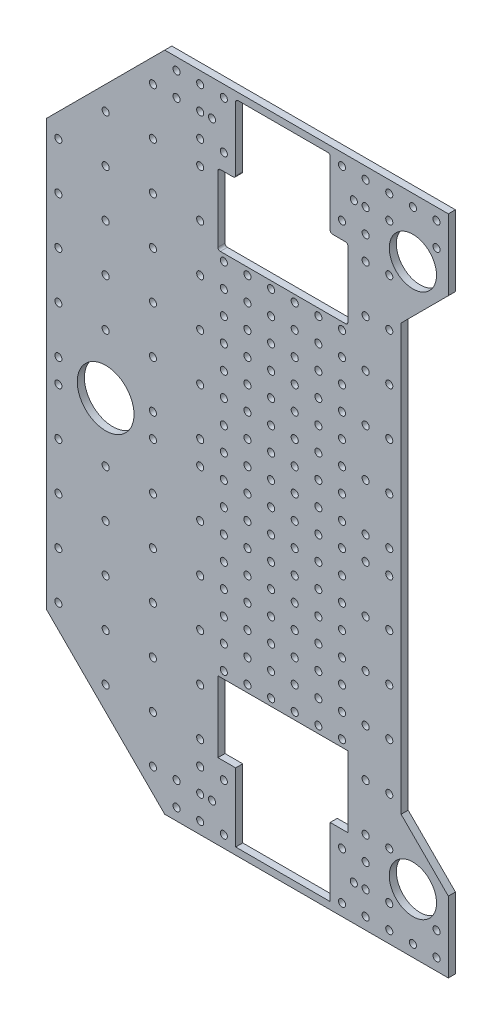
from build123d import *

# Parameters (mm, degrees)
MAIN_DEPTH                          = 3
MOTORCODERLEFTHOLE_DEPTH            = 179.070210872
FILLET1_R                           = 1
SKETCH7_R                           = 1.5
MOTORFIXHOLES_DEPTH                 = 179.070210872
MOTORFIXHOLELPATTERN_COUNT          = 8
MOTORFIXHOLELPATTERN_PITCH          = 10
SKETCH8_R                           = 1.5
LINEARBALLFIX_DEPTH                 = 179.070210872
LINEARBALLFIX2_COUNT                = 2
LINEARBALLFIX2_PITCH                = 60
SKETCH4_R                           = 1.5
BOTTOMLEFTHOLE_DEPTH                = 179.070210872
BOTTOMLEFTHOLELPATTERN_COUNT        = 9
BOTTOMLEFTHOLELPATTERN_PITCH        = 20
SKETCH5_R                           = 1.5
BOTTOMLEFTHOLE2_DEPTH               = 179.070210872
BOTTOMTOTOPPATTERN_COPY_1_SKETCH_R  = 1.5
BOTTOMTOTOPPATTERN_COPY_1_DEPTH     = 179.070210872
BOTTOMTOTOPPATTERN_COPY_2_SKETCH_R  = 1.5
BOTTOMTOTOPPATTERN_COPY_2_DEPTH     = 179.070210872
BOTTOMTOTOPPATTERN_COPY_3_SKETCH_R  = 1.5
BOTTOMTOTOPPATTERN_COPY_3_DEPTH     = 179.070210872
BOTTOMTOTOPPATTERN_COPY_4_SKETCH_R  = 1.5
BOTTOMTOTOPPATTERN_COPY_4_DEPTH     = 179.070210872
BOTTOMTOTOPPATTERN_COPY_5_SKETCH_R  = 1.5
BOTTOMTOTOPPATTERN_COPY_5_DEPTH     = 179.070210872
BOTTOMTOTOPPATTERN_COPY_6_SKETCH_R  = 1.5
BOTTOMTOTOPPATTERN_COPY_6_DEPTH     = 179.070210872
BOTTOMTOTOPPATTERN_COPY_7_SKETCH_R  = 1.5
BOTTOMTOTOPPATTERN_COPY_7_DEPTH     = 179.070210872
BOTTOMTOTOPPATTERN_COPY_8_SKETCH_R  = 1.5
BOTTOMTOTOPPATTERN_COPY_8_DEPTH     = 179.070210872
BOTTOMTOTOPPATTERN_COPY_9_SKETCH_R  = 1.5
BOTTOMTOTOPPATTERN_COPY_9_DEPTH     = 179.070210872
BOTTOMTOTOPPATTERN_COPY_10_SKETCH_R = 1.5
BOTTOMTOTOPPATTERN_COPY_10_DEPTH    = 179.070210872
BOTTOMTOTOPPATTERN_COPY_11_SKETCH_R = 1.5
BOTTOMTOTOPPATTERN_COPY_11_DEPTH    = 179.070210872
BOTTOMTOTOPPATTERN_COPY_12_SKETCH_R = 1.5
BOTTOMTOTOPPATTERN_COPY_12_DEPTH    = 179.070210872
BOTTOMTOTOPPATTERN_COPY_13_SKETCH_R = 1.5
BOTTOMTOTOPPATTERN_COPY_13_DEPTH    = 179.070210872
BOTTOMTOTOPPATTERN_COPY_14_SKETCH_R = 1.5
BOTTOMTOTOPPATTERN_COPY_14_DEPTH    = 179.070210872
BOTTOMTOTOPPATTERN_COPY_15_SKETCH_R = 1.5
BOTTOMTOTOPPATTERN_COPY_15_DEPTH    = 179.070210872
BOTTOMTOTOPPATTERN_COPY_16_SKETCH_R = 1.5
BOTTOMTOTOPPATTERN_COPY_16_DEPTH    = 179.070210872
BOTTOMTOTOPPATTERN_COPY_17_SKETCH_R = 1.5
BOTTOMTOTOPPATTERN_COPY_17_DEPTH    = 179.070210872
BOTTOMTOTOPPATTERN_COPY_18_SKETCH_R = 1.5
BOTTOMTOTOPPATTERN_COPY_18_DEPTH    = 179.070210872
BOTTOMTOTOPPATTERN_COPY_19_SKETCH_R = 1.5
BOTTOMTOTOPPATTERN_COPY_19_DEPTH    = 179.070210872
BOTTOMTOTOPPATTERN_COPY_20_SKETCH_R = 1.5
BOTTOMTOTOPPATTERN_COPY_20_DEPTH    = 179.070210872
BOTTOMTOTOPPATTERN_COPY_21_SKETCH_R = 1.5
BOTTOMTOTOPPATTERN_COPY_21_DEPTH    = 179.070210872
BOTTOMTOTOPPATTERN_COPY_22_SKETCH_R = 1.5
BOTTOMTOTOPPATTERN_COPY_22_DEPTH    = 179.070210872
BOTTOMTOTOPPATTERN_COPY_23_SKETCH_R = 1.5
BOTTOMTOTOPPATTERN_COPY_23_DEPTH    = 179.070210872
BOTTOMTOTOPPATTERN_COPY_24_SKETCH_R = 1.5
BOTTOMTOTOPPATTERN_COPY_24_DEPTH    = 179.070210872
BOTTOMTOTOPPATTERN_COPY_25_SKETCH_R = 1.5
BOTTOMTOTOPPATTERN_COPY_25_DEPTH    = 179.070210872
BOTTOMTOTOPPATTERN_COPY_26_SKETCH_R = 1.5
BOTTOMTOTOPPATTERN_COPY_26_DEPTH    = 179.070210872
BOTTOMTOTOPPATTERN_COPY_27_SKETCH_R = 1.5
BOTTOMTOTOPPATTERN_COPY_27_DEPTH    = 179.070210872
LPATTERN3_COUNT                     = 2
LPATTERN3_PITCH                     = 10
FRONTHOLES_COPY_1_SKETCH_R          = 1.5
FRONTHOLES_COPY_1_DEPTH             = 179.070210872
FRONTHOLES_COPY_2_SKETCH_R          = 1.5
FRONTHOLES_COPY_2_DEPTH             = 179.070210872
FRONTHOLES_COPY_3_SKETCH_R          = 1.5
FRONTHOLES_COPY_3_DEPTH             = 179.070210872
FRONTHOLES_COPY_4_SKETCH_R          = 1.5
FRONTHOLES_COPY_4_DEPTH             = 179.070210872
FRONTHOLES_COPY_5_SKETCH_R          = 1.5
FRONTHOLES_COPY_5_DEPTH             = 179.070210872
FRONTHOLES_COPY_6_SKETCH_R          = 1.5
FRONTHOLES_COPY_6_DEPTH             = 179.070210872
FRONTHOLES_COPY_7_SKETCH_R          = 1.5
FRONTHOLES_COPY_7_DEPTH             = 179.070210872
FRONTHOLES_COPY_8_SKETCH_R          = 1.5
FRONTHOLES_COPY_8_DEPTH             = 179.070210872
FRONTHOLES_COPY_9_SKETCH_R          = 1.5
FRONTHOLES_COPY_9_DEPTH             = 179.070210872
SKETCH9_R                           = 1.5
CUT_EXTRUDE2_DEPTH                  = 179.070210872
LPATTERN6_COPY_1_SKETCH_R           = 1.5
LPATTERN6_COPY_1_DEPTH              = 179.070210872
LPATTERN6_COPY_2_SKETCH_R           = 1.5
LPATTERN6_COPY_2_DEPTH              = 179.070210872
LPATTERN6_COPY_3_SKETCH_R           = 1.5
LPATTERN6_COPY_3_DEPTH              = 179.070210872
LPATTERN6_COPY_4_SKETCH_R           = 1.5
LPATTERN6_COPY_4_DEPTH              = 179.070210872
LPATTERN6_COPY_5_SKETCH_R           = 1.5
LPATTERN6_COPY_5_DEPTH              = 179.070210872
LPATTERN6_COPY_6_SKETCH_R           = 1.5
LPATTERN6_COPY_6_DEPTH              = 179.070210872
LPATTERN6_COPY_7_SKETCH_R           = 1.5
LPATTERN6_COPY_7_DEPTH              = 179.070210872
LPATTERN6_COPY_8_SKETCH_R           = 1.5
LPATTERN6_COPY_8_DEPTH              = 179.070210872
LPATTERN6_COPY_9_SKETCH_R           = 1.5
LPATTERN6_COPY_9_DEPTH              = 179.070210872
MIRROR1_COPY_1_SKETCH_R             = 1.5
MIRROR1_COPY_1_DEPTH                = 179.070210872
MIRROR1_COPY_2_SKETCH_R             = 1.5
MIRROR1_COPY_2_DEPTH                = 179.070210872
MIRROR1_COPY_3_SKETCH_R             = 1.5
MIRROR1_COPY_3_DEPTH                = 179.070210872
MIRROR1_COPY_4_SKETCH_R             = 1.5
MIRROR1_COPY_4_DEPTH                = 179.070210872
MIRROR1_COPY_5_SKETCH_R             = 1.5
MIRROR1_COPY_5_DEPTH                = 179.070210872
MIRROR1_COPY_6_SKETCH_R             = 1.5
MIRROR1_COPY_6_DEPTH                = 179.070210872
MIRROR1_COPY_7_SKETCH_R             = 1.5
MIRROR1_COPY_7_DEPTH                = 179.070210872
MIRROR1_COPY_8_SKETCH_R             = 1.5
MIRROR1_COPY_8_DEPTH                = 179.070210872
MIRROR1_COPY_9_SKETCH_R             = 1.5
MIRROR1_COPY_9_DEPTH                = 179.070210872
MIRROR1_COPY_10_SKETCH_R            = 1.5
MIRROR1_COPY_10_DEPTH               = 179.070210872
MIRROR1_COPY_11_SKETCH_R            = 1.5
MIRROR1_COPY_11_DEPTH               = 179.070210872
MIRROR1_COPY_12_SKETCH_R            = 1.5
MIRROR1_COPY_12_DEPTH               = 179.070210872
MIRROR1_COPY_13_SKETCH_R            = 1.5
MIRROR1_COPY_13_DEPTH               = 179.070210872
MIRROR1_COPY_14_SKETCH_R            = 1.5
MIRROR1_COPY_14_DEPTH               = 179.070210872
MIRROR1_COPY_15_SKETCH_R            = 1.5
MIRROR1_COPY_15_DEPTH               = 179.070210872
MIRROR1_COPY_16_SKETCH_R            = 1.5
MIRROR1_COPY_16_DEPTH               = 179.070210872
MIRROR1_COPY_17_SKETCH_R            = 1.5
MIRROR1_COPY_17_DEPTH               = 179.070210872
MIRROR1_COPY_18_SKETCH_R            = 1.5
MIRROR1_COPY_18_DEPTH               = 179.070210872
MIRROR1_COPY_19_SKETCH_R            = 1.5
MIRROR1_COPY_19_DEPTH               = 179.070210872
MIRROR1_COPY_20_SKETCH_R            = 1.5
MIRROR1_COPY_20_DEPTH               = 179.070210872
MIRROR1_COPY_21_SKETCH_R            = 1.5
MIRROR1_COPY_21_DEPTH               = 179.070210872
MIRROR1_COPY_22_SKETCH_R            = 1.5
MIRROR1_COPY_22_DEPTH               = 179.070210872
MIRROR1_COPY_23_SKETCH_R            = 1.5
MIRROR1_COPY_23_DEPTH               = 179.070210872
MIRROR1_COPY_24_SKETCH_R            = 1.5
MIRROR1_COPY_24_DEPTH               = 179.070210872
MIRROR1_COPY_25_SKETCH_R            = 1.5
MIRROR1_COPY_25_DEPTH               = 179.070210872
MIRROR1_COPY_26_SKETCH_R            = 1.5
MIRROR1_COPY_26_DEPTH               = 179.070210872
MIRROR1_COPY_27_SKETCH_R            = 1.5
MIRROR1_COPY_27_DEPTH               = 179.070210872
MIRROR1_COPY_28_SKETCH_R            = 1.5
MIRROR1_COPY_28_DEPTH               = 179.070210872
MIRROR1_COPY_29_SKETCH_R            = 1.5
MIRROR1_COPY_29_DEPTH               = 179.070210872
MIRROR1_COPY_30_SKETCH_R            = 1.5
MIRROR1_COPY_30_DEPTH               = 179.070210872
MIRROR1_COPY_31_SKETCH_R            = 1.5
MIRROR1_COPY_31_DEPTH               = 179.070210872
MIRROR1_COPY_32_SKETCH_R            = 1.5
MIRROR1_COPY_32_DEPTH               = 179.070210872
MIRROR1_COPY_33_SKETCH_R            = 1.5
MIRROR1_COPY_33_DEPTH               = 179.070210872
MIRROR1_COPY_34_SKETCH_R            = 1.5
MIRROR1_COPY_34_DEPTH               = 179.070210872
MIRROR1_COPY_35_SKETCH_R            = 1.5
MIRROR1_COPY_35_DEPTH               = 179.070210872
MIRROR1_COPY_36_SKETCH_R            = 1.5
MIRROR1_COPY_36_DEPTH               = 179.070210872
MIRROR1_COPY_37_SKETCH_R            = 1.5
MIRROR1_COPY_37_DEPTH               = 179.070210872
MIRROR1_COPY_38_SKETCH_R            = 1.5
MIRROR1_COPY_38_DEPTH               = 179.070210872
MIRROR1_COPY_39_SKETCH_R            = 1.5
MIRROR1_COPY_39_DEPTH               = 179.070210872
MIRROR1_COPY_40_SKETCH_R            = 1.5
MIRROR1_COPY_40_DEPTH               = 179.070210872
MIRROR1_COPY_41_SKETCH_R            = 1.5
MIRROR1_COPY_41_DEPTH               = 179.070210872
MIRROR1_COPY_42_SKETCH_R            = 1.5
MIRROR1_COPY_42_DEPTH               = 179.070210872
MIRROR1_COPY_43_SKETCH_R            = 1.5
MIRROR1_COPY_43_DEPTH               = 179.070210872
MIRROR1_COPY_44_SKETCH_R            = 1.5
MIRROR1_COPY_44_DEPTH               = 179.070210872
MIRROR1_COPY_45_SKETCH_R            = 1.5
MIRROR1_COPY_45_DEPTH               = 179.070210872
MIRROR1_COPY_46_SKETCH_R            = 1.5
MIRROR1_COPY_46_DEPTH               = 179.070210872
MIRROR1_COPY_47_SKETCH_R            = 1.5
MIRROR1_COPY_47_DEPTH               = 179.070210872
MIRROR1_COPY_48_SKETCH_R            = 1.5
MIRROR1_COPY_48_DEPTH               = 179.070210872
MIRROR1_COPY_49_SKETCH_R            = 1.5
MIRROR1_COPY_49_DEPTH               = 179.070210872
MIRROR1_COPY_50_SKETCH_R            = 1.5
MIRROR1_COPY_50_DEPTH               = 179.070210872
MIRROR1_COPY_51_SKETCH_R            = 1.5
MIRROR1_COPY_51_DEPTH               = 179.070210872
MIRROR1_COPY_52_SKETCH_R            = 1.5
MIRROR1_COPY_52_DEPTH               = 179.070210872
MIRROR1_COPY_53_SKETCH_R            = 1.5
MIRROR1_COPY_53_DEPTH               = 179.070210872
MIRROR1_COPY_54_SKETCH_R            = 1.5
MIRROR1_COPY_54_DEPTH               = 179.070210872
MIRROR1_COPY_55_SKETCH_R            = 1.5
MIRROR1_COPY_55_DEPTH               = 179.070210872
MIRROR1_COPY_56_SKETCH_R            = 1.5
MIRROR1_COPY_56_DEPTH               = 179.070210872
MIRROR1_COPY_57_SKETCH_R            = 1.5
MIRROR1_COPY_57_DEPTH               = 179.070210872
MIRROR1_COPY_58_SKETCH_R            = 1.5
MIRROR1_COPY_58_DEPTH               = 179.070210872
MIRROR1_COPY_59_SKETCH_R            = 1.5
MIRROR1_COPY_59_DEPTH               = 179.070210872
MIRROR1_COPY_60_SKETCH_R            = 1.5
MIRROR1_COPY_60_DEPTH               = 179.070210872
MIRROR1_COPY_61_SKETCH_R            = 1.5
MIRROR1_COPY_61_DEPTH               = 179.070210872
MIRROR1_COPY_62_SKETCH_R            = 1.5
MIRROR1_COPY_62_DEPTH               = 179.070210872
SKETCH3_R                           = 12
SKETCH3_R_2                         = 10
BIGHOLES_DEPTH                      = 179.070210872


with BuildPart() as part:
    # Sketch1 → Main (new body)
    with BuildSketch(Plane.XY):
        Polygon((-110, 90), (-110, -90), (-60, -140), (60, -140), (60, -110), (40, -90), (40, 90), (60, 110), (60, 140), (-60, 140), align=None)
    extrude(amount=MAIN_DEPTH)

    # Sketch2 → MotorCoderLeftHole (cut, through all)
    with BuildSketch(Plane.XY.offset(3)):
        Polygon((-37.5, 108), (-37.5, 78), (17.5, 78), (17.5, 108), (10, 108), (10, 137), (-30, 137), (-30, 108), align=None)
    motorcoderlefthole = extrude(amount=-MOTORCODERLEFTHOLE_DEPTH, mode=Mode.SUBTRACT)

    # Fillet1
    fillet1_edges = [part.edges().sort_by_distance(p)[0] for p in [
        (-30, 137, 1.5),
        (10, 108, 1.5),
        (17.5, 108, 1.5),
        (10, 137, 1.5),
        (17.5, 78, 1.5),
        (-37.5, 78, 1.5),
        (-37.5, 108, 1.5),
        (-30, 108, 1.5),
    ]]
    fillet(fillet1_edges, radius=FILLET1_R)

    # Sketch7 → MotorFixHoles (cut, through all)
    with BuildSketch(Plane.XY.offset(3)):
        with Locations((-15, 75)):
            Circle(SKETCH7_R)
        with Locations((-25, 75)):
            Circle(SKETCH7_R)
        with Locations((-5, 75)):
            Circle(SKETCH7_R)
        with Locations((-35, 75)):
            Circle(SKETCH7_R)
        with Locations((5, 75)):
            Circle(SKETCH7_R)
        with Locations((15, 75)):
            Circle(SKETCH7_R)
    motorfixholes = extrude(amount=-MOTORFIXHOLES_DEPTH, mode=Mode.SUBTRACT)

    # MotorFixHoleLPattern: MotorFixHoles ×8
    with Locations(*[(0, -i * MOTORFIXHOLELPATTERN_PITCH, 0) for i in range(1, MOTORFIXHOLELPATTERN_COUNT)]):
        add(motorfixholes, mode=Mode.SUBTRACT)

    # Sketch8 → LinearBallFix (cut, through all)
    with BuildSketch(Plane.XY.offset(3)):
        with Locations((-40, 125)):
            Circle(SKETCH8_R)
        with Locations((-45, 115)):
            Circle(SKETCH8_R)
        with Locations((-35, 115)):
            Circle(SKETCH8_R)
        with Locations((-45, 135)):
            Circle(SKETCH8_R)
        with Locations((-35, 135)):
            Circle(SKETCH8_R)
    linearballfix = extrude(amount=-LINEARBALLFIX_DEPTH, mode=Mode.SUBTRACT)

    # LinearBallFix2: LinearBallFix ×2
    with Locations(*[(i * LINEARBALLFIX2_PITCH, 0, 0) for i in range(1, LINEARBALLFIX2_COUNT)]):
        add(linearballfix, mode=Mode.SUBTRACT)

    # Sketch4 → BottomLeftHole (cut, through all)
    with BuildSketch(Plane.XY.offset(3)):
        with Locations((-105, 5)):
            Circle(SKETCH4_R)
    bottomlefthole = extrude(amount=-BOTTOMLEFTHOLE_DEPTH, mode=Mode.SUBTRACT)

    # BottomLeftHoleLPattern: BottomLeftHole ×9
    with Locations(*[(0, i * BOTTOMLEFTHOLELPATTERN_PITCH, 0) for i in range(1, BOTTOMLEFTHOLELPATTERN_COUNT)]):
        add(bottomlefthole, mode=Mode.SUBTRACT)

    # Sketch5 → BottomLeftHole2 (cut, through all)
    with BuildSketch(Plane.XY.offset(3)):
        with Locations((-55, 135)):
            Circle(SKETCH5_R)
        with Locations((35, 135)):
            Circle(SKETCH5_R)
        with Locations((55, 135)):
            Circle(SKETCH5_R)
    bottomlefthole2 = extrude(amount=-BOTTOMLEFTHOLE2_DEPTH, mode=Mode.SUBTRACT)

    # BottomToTopPattern copy 1 sketch → BottomToTopPattern copy 1 (cut, through all)
    with BuildSketch(Plane(origin=(20, 20, 3), x_dir=(1, 0, 0), z_dir=(0, 0, 1))):
        with Locations((-105, 5)):
            Circle(BOTTOMTOTOPPATTERN_COPY_1_SKETCH_R)
    extrude(amount=-BOTTOMTOTOPPATTERN_COPY_1_DEPTH, mode=Mode.SUBTRACT)

    # BottomToTopPattern copy 2 sketch → BottomToTopPattern copy 2 (cut, through all)
    with BuildSketch(Plane(origin=(40, 20, 3), x_dir=(1, 0, 0), z_dir=(0, 0, 1))):
        with Locations((-105, 5)):
            Circle(BOTTOMTOTOPPATTERN_COPY_2_SKETCH_R)
    extrude(amount=-BOTTOMTOTOPPATTERN_COPY_2_DEPTH, mode=Mode.SUBTRACT)

    # BottomToTopPattern copy 3 sketch → BottomToTopPattern copy 3 (cut, through all)
    with BuildSketch(Plane(origin=(60, 20, 3), x_dir=(1, 0, 0), z_dir=(0, 0, 1))):
        with Locations((-105, 5)):
            Circle(BOTTOMTOTOPPATTERN_COPY_3_SKETCH_R)
    extrude(amount=-BOTTOMTOTOPPATTERN_COPY_3_DEPTH, mode=Mode.SUBTRACT)

    # BottomToTopPattern copy 4 sketch → BottomToTopPattern copy 4 (cut, through all)
    with BuildSketch(Plane(origin=(20, 40, 3), x_dir=(1, 0, 0), z_dir=(0, 0, 1))):
        with Locations((-105, 5)):
            Circle(BOTTOMTOTOPPATTERN_COPY_4_SKETCH_R)
    extrude(amount=-BOTTOMTOTOPPATTERN_COPY_4_DEPTH, mode=Mode.SUBTRACT)

    # BottomToTopPattern copy 5 sketch → BottomToTopPattern copy 5 (cut, through all)
    with BuildSketch(Plane(origin=(40, 40, 3), x_dir=(1, 0, 0), z_dir=(0, 0, 1))):
        with Locations((-105, 5)):
            Circle(BOTTOMTOTOPPATTERN_COPY_5_SKETCH_R)
    extrude(amount=-BOTTOMTOTOPPATTERN_COPY_5_DEPTH, mode=Mode.SUBTRACT)

    # BottomToTopPattern copy 6 sketch → BottomToTopPattern copy 6 (cut, through all)
    with BuildSketch(Plane(origin=(60, 40, 3), x_dir=(1, 0, 0), z_dir=(0, 0, 1))):
        with Locations((-105, 5)):
            Circle(BOTTOMTOTOPPATTERN_COPY_6_SKETCH_R)
    extrude(amount=-BOTTOMTOTOPPATTERN_COPY_6_DEPTH, mode=Mode.SUBTRACT)

    # BottomToTopPattern copy 7 sketch → BottomToTopPattern copy 7 (cut, through all)
    with BuildSketch(Plane(origin=(20, 60, 3), x_dir=(1, 0, 0), z_dir=(0, 0, 1))):
        with Locations((-105, 5)):
            Circle(BOTTOMTOTOPPATTERN_COPY_7_SKETCH_R)
    extrude(amount=-BOTTOMTOTOPPATTERN_COPY_7_DEPTH, mode=Mode.SUBTRACT)

    # BottomToTopPattern copy 8 sketch → BottomToTopPattern copy 8 (cut, through all)
    with BuildSketch(Plane(origin=(40, 60, 3), x_dir=(1, 0, 0), z_dir=(0, 0, 1))):
        with Locations((-105, 5)):
            Circle(BOTTOMTOTOPPATTERN_COPY_8_SKETCH_R)
    extrude(amount=-BOTTOMTOTOPPATTERN_COPY_8_DEPTH, mode=Mode.SUBTRACT)

    # BottomToTopPattern copy 9 sketch → BottomToTopPattern copy 9 (cut, through all)
    with BuildSketch(Plane(origin=(60, 60, 3), x_dir=(1, 0, 0), z_dir=(0, 0, 1))):
        with Locations((-105, 5)):
            Circle(BOTTOMTOTOPPATTERN_COPY_9_SKETCH_R)
    extrude(amount=-BOTTOMTOTOPPATTERN_COPY_9_DEPTH, mode=Mode.SUBTRACT)

    # BottomToTopPattern copy 10 sketch → BottomToTopPattern copy 10 (cut, through all)
    with BuildSketch(Plane(origin=(20, 80, 3), x_dir=(1, 0, 0), z_dir=(0, 0, 1))):
        with Locations((-105, 5)):
            Circle(BOTTOMTOTOPPATTERN_COPY_10_SKETCH_R)
    extrude(amount=-BOTTOMTOTOPPATTERN_COPY_10_DEPTH, mode=Mode.SUBTRACT)

    # BottomToTopPattern copy 11 sketch → BottomToTopPattern copy 11 (cut, through all)
    with BuildSketch(Plane(origin=(40, 80, 3), x_dir=(1, 0, 0), z_dir=(0, 0, 1))):
        with Locations((-105, 5)):
            Circle(BOTTOMTOTOPPATTERN_COPY_11_SKETCH_R)
    extrude(amount=-BOTTOMTOTOPPATTERN_COPY_11_DEPTH, mode=Mode.SUBTRACT)

    # BottomToTopPattern copy 12 sketch → BottomToTopPattern copy 12 (cut, through all)
    with BuildSketch(Plane(origin=(60, 80, 3), x_dir=(1, 0, 0), z_dir=(0, 0, 1))):
        with Locations((-105, 5)):
            Circle(BOTTOMTOTOPPATTERN_COPY_12_SKETCH_R)
    extrude(amount=-BOTTOMTOTOPPATTERN_COPY_12_DEPTH, mode=Mode.SUBTRACT)

    # BottomToTopPattern copy 13 sketch → BottomToTopPattern copy 13 (cut, through all)
    with BuildSketch(Plane(origin=(20, 100, 3), x_dir=(1, 0, 0), z_dir=(0, 0, 1))):
        with Locations((-105, 5)):
            Circle(BOTTOMTOTOPPATTERN_COPY_13_SKETCH_R)
    extrude(amount=-BOTTOMTOTOPPATTERN_COPY_13_DEPTH, mode=Mode.SUBTRACT)

    # BottomToTopPattern copy 14 sketch → BottomToTopPattern copy 14 (cut, through all)
    with BuildSketch(Plane(origin=(40, 100, 3), x_dir=(1, 0, 0), z_dir=(0, 0, 1))):
        with Locations((-105, 5)):
            Circle(BOTTOMTOTOPPATTERN_COPY_14_SKETCH_R)
    extrude(amount=-BOTTOMTOTOPPATTERN_COPY_14_DEPTH, mode=Mode.SUBTRACT)

    # BottomToTopPattern copy 15 sketch → BottomToTopPattern copy 15 (cut, through all)
    with BuildSketch(Plane(origin=(60, 100, 3), x_dir=(1, 0, 0), z_dir=(0, 0, 1))):
        with Locations((-105, 5)):
            Circle(BOTTOMTOTOPPATTERN_COPY_15_SKETCH_R)
    extrude(amount=-BOTTOMTOTOPPATTERN_COPY_15_DEPTH, mode=Mode.SUBTRACT)

    # BottomToTopPattern copy 16 sketch → BottomToTopPattern copy 16 (cut, through all)
    with BuildSketch(Plane(origin=(20, 120, 3), x_dir=(1, 0, 0), z_dir=(0, 0, 1))):
        with Locations((-105, 5)):
            Circle(BOTTOMTOTOPPATTERN_COPY_16_SKETCH_R)
    extrude(amount=-BOTTOMTOTOPPATTERN_COPY_16_DEPTH, mode=Mode.SUBTRACT)

    # BottomToTopPattern copy 17 sketch → BottomToTopPattern copy 17 (cut, through all)
    with BuildSketch(Plane(origin=(40, 120, 3), x_dir=(1, 0, 0), z_dir=(0, 0, 1))):
        with Locations((-105, 5)):
            Circle(BOTTOMTOTOPPATTERN_COPY_17_SKETCH_R)
    extrude(amount=-BOTTOMTOTOPPATTERN_COPY_17_DEPTH, mode=Mode.SUBTRACT)

    # BottomToTopPattern copy 18 sketch → BottomToTopPattern copy 18 (cut, through all)
    with BuildSketch(Plane(origin=(60, 120, 3), x_dir=(1, 0, 0), z_dir=(0, 0, 1))):
        with Locations((-105, 5)):
            Circle(BOTTOMTOTOPPATTERN_COPY_18_SKETCH_R)
    extrude(amount=-BOTTOMTOTOPPATTERN_COPY_18_DEPTH, mode=Mode.SUBTRACT)

    # BottomToTopPattern copy 19 sketch → BottomToTopPattern copy 19 (cut, through all)
    with BuildSketch(Plane(origin=(20, 140, 3), x_dir=(1, 0, 0), z_dir=(0, 0, 1))):
        with Locations((-105, 5)):
            Circle(BOTTOMTOTOPPATTERN_COPY_19_SKETCH_R)
    extrude(amount=-BOTTOMTOTOPPATTERN_COPY_19_DEPTH, mode=Mode.SUBTRACT)

    # BottomToTopPattern copy 20 sketch → BottomToTopPattern copy 20 (cut, through all)
    with BuildSketch(Plane(origin=(40, 140, 3), x_dir=(1, 0, 0), z_dir=(0, 0, 1))):
        with Locations((-105, 5)):
            Circle(BOTTOMTOTOPPATTERN_COPY_20_SKETCH_R)
    extrude(amount=-BOTTOMTOTOPPATTERN_COPY_20_DEPTH, mode=Mode.SUBTRACT)

    # BottomToTopPattern copy 21 sketch → BottomToTopPattern copy 21 (cut, through all)
    with BuildSketch(Plane(origin=(60, 140, 3), x_dir=(1, 0, 0), z_dir=(0, 0, 1))):
        with Locations((-105, 5)):
            Circle(BOTTOMTOTOPPATTERN_COPY_21_SKETCH_R)
    extrude(amount=-BOTTOMTOTOPPATTERN_COPY_21_DEPTH, mode=Mode.SUBTRACT)

    # BottomToTopPattern copy 22 sketch → BottomToTopPattern copy 22 (cut, through all)
    with BuildSketch(Plane(origin=(20, 160, 3), x_dir=(1, 0, 0), z_dir=(0, 0, 1))):
        with Locations((-105, 5)):
            Circle(BOTTOMTOTOPPATTERN_COPY_22_SKETCH_R)
    extrude(amount=-BOTTOMTOTOPPATTERN_COPY_22_DEPTH, mode=Mode.SUBTRACT)

    # BottomToTopPattern copy 23 sketch → BottomToTopPattern copy 23 (cut, through all)
    with BuildSketch(Plane(origin=(40, 160, 3), x_dir=(1, 0, 0), z_dir=(0, 0, 1))):
        with Locations((-105, 5)):
            Circle(BOTTOMTOTOPPATTERN_COPY_23_SKETCH_R)
    extrude(amount=-BOTTOMTOTOPPATTERN_COPY_23_DEPTH, mode=Mode.SUBTRACT)

    # BottomToTopPattern copy 24 sketch → BottomToTopPattern copy 24 (cut, through all)
    with BuildSketch(Plane(origin=(60, 160, 3), x_dir=(1, 0, 0), z_dir=(0, 0, 1))):
        with Locations((-105, 5)):
            Circle(BOTTOMTOTOPPATTERN_COPY_24_SKETCH_R)
    extrude(amount=-BOTTOMTOTOPPATTERN_COPY_24_DEPTH, mode=Mode.SUBTRACT)

    # BottomToTopPattern copy 25 sketch → BottomToTopPattern copy 25 (cut, through all)
    with BuildSketch(Plane(origin=(20, 0, 3), x_dir=(1, 0, 0), z_dir=(0, 0, 1))):
        with Locations((-105, 5)):
            Circle(BOTTOMTOTOPPATTERN_COPY_25_SKETCH_R)
    extrude(amount=-BOTTOMTOTOPPATTERN_COPY_25_DEPTH, mode=Mode.SUBTRACT)

    # BottomToTopPattern copy 26 sketch → BottomToTopPattern copy 26 (cut, through all)
    with BuildSketch(Plane(origin=(40, 0, 3), x_dir=(1, 0, 0), z_dir=(0, 0, 1))):
        with Locations((-105, 5)):
            Circle(BOTTOMTOTOPPATTERN_COPY_26_SKETCH_R)
    extrude(amount=-BOTTOMTOTOPPATTERN_COPY_26_DEPTH, mode=Mode.SUBTRACT)

    # BottomToTopPattern copy 27 sketch → BottomToTopPattern copy 27 (cut, through all)
    with BuildSketch(Plane(origin=(60, 0, 3), x_dir=(1, 0, 0), z_dir=(0, 0, 1))):
        with Locations((-105, 5)):
            Circle(BOTTOMTOTOPPATTERN_COPY_27_SKETCH_R)
    extrude(amount=-BOTTOMTOTOPPATTERN_COPY_27_DEPTH, mode=Mode.SUBTRACT)

    # LPattern3: BottomLeftHole2 ×2
    with Locations(*[(0, -i * LPATTERN3_PITCH, 0) for i in range(1, LPATTERN3_COUNT)]):
        add(bottomlefthole2, mode=Mode.SUBTRACT)

    # FrontHoles copy 1 sketch → FrontHoles copy 1 (cut, through all)
    with BuildSketch(Plane(origin=(140, 20, 3), x_dir=(1, 0, 0), z_dir=(0, 0, 1))):
        with Locations((-105, 5)):
            Circle(FRONTHOLES_COPY_1_SKETCH_R)
    extrude(amount=-FRONTHOLES_COPY_1_DEPTH, mode=Mode.SUBTRACT)

    # FrontHoles copy 2 sketch → FrontHoles copy 2 (cut, through all)
    with BuildSketch(Plane(origin=(140, 40, 3), x_dir=(1, 0, 0), z_dir=(0, 0, 1))):
        with Locations((-105, 5)):
            Circle(FRONTHOLES_COPY_2_SKETCH_R)
    extrude(amount=-FRONTHOLES_COPY_2_DEPTH, mode=Mode.SUBTRACT)

    # FrontHoles copy 3 sketch → FrontHoles copy 3 (cut, through all)
    with BuildSketch(Plane(origin=(140, 60, 3), x_dir=(1, 0, 0), z_dir=(0, 0, 1))):
        with Locations((-105, 5)):
            Circle(FRONTHOLES_COPY_3_SKETCH_R)
    extrude(amount=-FRONTHOLES_COPY_3_DEPTH, mode=Mode.SUBTRACT)

    # FrontHoles copy 4 sketch → FrontHoles copy 4 (cut, through all)
    with BuildSketch(Plane(origin=(140, 80, 3), x_dir=(1, 0, 0), z_dir=(0, 0, 1))):
        with Locations((-105, 5)):
            Circle(FRONTHOLES_COPY_4_SKETCH_R)
    extrude(amount=-FRONTHOLES_COPY_4_DEPTH, mode=Mode.SUBTRACT)

    # FrontHoles copy 5 sketch → FrontHoles copy 5 (cut, through all)
    with BuildSketch(Plane(origin=(140, 100, 3), x_dir=(1, 0, 0), z_dir=(0, 0, 1))):
        with Locations((-105, 5)):
            Circle(FRONTHOLES_COPY_5_SKETCH_R)
    extrude(amount=-FRONTHOLES_COPY_5_DEPTH, mode=Mode.SUBTRACT)

    # FrontHoles copy 6 sketch → FrontHoles copy 6 (cut, through all)
    with BuildSketch(Plane(origin=(140, 120, 3), x_dir=(1, 0, 0), z_dir=(0, 0, 1))):
        with Locations((-105, 5)):
            Circle(FRONTHOLES_COPY_6_SKETCH_R)
    extrude(amount=-FRONTHOLES_COPY_6_DEPTH, mode=Mode.SUBTRACT)

    # FrontHoles copy 7 sketch → FrontHoles copy 7 (cut, through all)
    with BuildSketch(Plane(origin=(140, 140, 3), x_dir=(1, 0, 0), z_dir=(0, 0, 1))):
        with Locations((-105, 5)):
            Circle(FRONTHOLES_COPY_7_SKETCH_R)
    extrude(amount=-FRONTHOLES_COPY_7_DEPTH, mode=Mode.SUBTRACT)

    # FrontHoles copy 8 sketch → FrontHoles copy 8 (cut, through all)
    with BuildSketch(Plane(origin=(140, 160, 3), x_dir=(1, 0, 0), z_dir=(0, 0, 1))):
        with Locations((-105, 5)):
            Circle(FRONTHOLES_COPY_8_SKETCH_R)
    extrude(amount=-FRONTHOLES_COPY_8_DEPTH, mode=Mode.SUBTRACT)

    # FrontHoles copy 9 sketch → FrontHoles copy 9 (cut, through all)
    with BuildSketch(Plane(origin=(140, 0, 3), x_dir=(1, 0, 0), z_dir=(0, 0, 1))):
        with Locations((-105, 5)):
            Circle(FRONTHOLES_COPY_9_SKETCH_R)
    extrude(amount=-FRONTHOLES_COPY_9_DEPTH, mode=Mode.SUBTRACT)

    # Sketch9 → Cut-Extrude2 (cut, through all)
    with BuildSketch(Plane.XY.offset(3)):
        with Locations((-85, 25)):
            Circle(SKETCH9_R)
        with Locations((-65, 25)):
            Circle(SKETCH9_R)
        with Locations((-45, 25)):
            Circle(SKETCH9_R)
        with Locations((-65, 45)):
            Circle(SKETCH9_R)
        with Locations((35, 105)):
            Circle(SKETCH9_R)
        with Locations((45, 135)):
            Circle(SKETCH9_R)
    cut_extrude2 = extrude(amount=-CUT_EXTRUDE2_DEPTH, mode=Mode.SUBTRACT)

    # LPattern6 copy 1 sketch → LPattern6 copy 1 (cut, through all)
    with BuildSketch(Plane(origin=(130, 20, 3), x_dir=(1, 0, 0), z_dir=(0, 0, 1))):
        with Locations((-105, 5)):
            Circle(LPATTERN6_COPY_1_SKETCH_R)
    extrude(amount=-LPATTERN6_COPY_1_DEPTH, mode=Mode.SUBTRACT)

    # LPattern6 copy 2 sketch → LPattern6 copy 2 (cut, through all)
    with BuildSketch(Plane(origin=(130, 40, 3), x_dir=(1, 0, 0), z_dir=(0, 0, 1))):
        with Locations((-105, 5)):
            Circle(LPATTERN6_COPY_2_SKETCH_R)
    extrude(amount=-LPATTERN6_COPY_2_DEPTH, mode=Mode.SUBTRACT)

    # LPattern6 copy 3 sketch → LPattern6 copy 3 (cut, through all)
    with BuildSketch(Plane(origin=(130, 60, 3), x_dir=(1, 0, 0), z_dir=(0, 0, 1))):
        with Locations((-105, 5)):
            Circle(LPATTERN6_COPY_3_SKETCH_R)
    extrude(amount=-LPATTERN6_COPY_3_DEPTH, mode=Mode.SUBTRACT)

    # LPattern6 copy 4 sketch → LPattern6 copy 4 (cut, through all)
    with BuildSketch(Plane(origin=(130, 80, 3), x_dir=(1, 0, 0), z_dir=(0, 0, 1))):
        with Locations((-105, 5)):
            Circle(LPATTERN6_COPY_4_SKETCH_R)
    extrude(amount=-LPATTERN6_COPY_4_DEPTH, mode=Mode.SUBTRACT)

    # LPattern6 copy 5 sketch → LPattern6 copy 5 (cut, through all)
    with BuildSketch(Plane(origin=(130, 100, 3), x_dir=(1, 0, 0), z_dir=(0, 0, 1))):
        with Locations((-105, 5)):
            Circle(LPATTERN6_COPY_5_SKETCH_R)
    extrude(amount=-LPATTERN6_COPY_5_DEPTH, mode=Mode.SUBTRACT)

    # LPattern6 copy 6 sketch → LPattern6 copy 6 (cut, through all)
    with BuildSketch(Plane(origin=(130, 120, 3), x_dir=(1, 0, 0), z_dir=(0, 0, 1))):
        with Locations((-105, 5)):
            Circle(LPATTERN6_COPY_6_SKETCH_R)
    extrude(amount=-LPATTERN6_COPY_6_DEPTH, mode=Mode.SUBTRACT)

    # LPattern6 copy 7 sketch → LPattern6 copy 7 (cut, through all)
    with BuildSketch(Plane(origin=(130, 140, 3), x_dir=(1, 0, 0), z_dir=(0, 0, 1))):
        with Locations((-105, 5)):
            Circle(LPATTERN6_COPY_7_SKETCH_R)
    extrude(amount=-LPATTERN6_COPY_7_DEPTH, mode=Mode.SUBTRACT)

    # LPattern6 copy 8 sketch → LPattern6 copy 8 (cut, through all)
    with BuildSketch(Plane(origin=(130, 160, 3), x_dir=(1, 0, 0), z_dir=(0, 0, 1))):
        with Locations((-105, 5)):
            Circle(LPATTERN6_COPY_8_SKETCH_R)
    extrude(amount=-LPATTERN6_COPY_8_DEPTH, mode=Mode.SUBTRACT)

    # LPattern6 copy 9 sketch → LPattern6 copy 9 (cut, through all)
    with BuildSketch(Plane(origin=(130, 0, 3), x_dir=(1, 0, 0), z_dir=(0, 0, 1))):
        with Locations((-105, 5)):
            Circle(LPATTERN6_COPY_9_SKETCH_R)
    extrude(amount=-LPATTERN6_COPY_9_DEPTH, mode=Mode.SUBTRACT)

    # Mirror1: MotorCoderLeftHole, MotorFixHoles, LinearBallFix, BottomLeftHole, BottomLeftHole2, Cut-Extrude2 across plane
    add(motorcoderlefthole.mirror(Plane.ZX), mode=Mode.SUBTRACT)
    add(motorfixholes.mirror(Plane.ZX), mode=Mode.SUBTRACT)
    add(linearballfix.mirror(Plane.ZX), mode=Mode.SUBTRACT)
    add(bottomlefthole.mirror(Plane.ZX), mode=Mode.SUBTRACT)
    add(bottomlefthole2.mirror(Plane.ZX), mode=Mode.SUBTRACT)
    add(cut_extrude2.mirror(Plane.ZX), mode=Mode.SUBTRACT)

    # Mirror1 copy 1 sketch → Mirror1 copy 1 (cut, through all)
    with BuildSketch(Plane(origin=(0, 10, 3), x_dir=(1, 0, 0), z_dir=(0, 0, 1))):
        with Locations((-15, -75)):
            Circle(MIRROR1_COPY_1_SKETCH_R)
        with Locations((-25, -75)):
            Circle(MIRROR1_COPY_1_SKETCH_R)
        with Locations((-5, -75)):
            Circle(MIRROR1_COPY_1_SKETCH_R)
        with Locations((-35, -75)):
            Circle(MIRROR1_COPY_1_SKETCH_R)
        with Locations((5, -75)):
            Circle(MIRROR1_COPY_1_SKETCH_R)
        with Locations((15, -75)):
            Circle(MIRROR1_COPY_1_SKETCH_R)
    extrude(amount=-MIRROR1_COPY_1_DEPTH, mode=Mode.SUBTRACT)

    # Mirror1 copy 2 sketch → Mirror1 copy 2 (cut, through all)
    with BuildSketch(Plane(origin=(0, 20, 3), x_dir=(1, 0, 0), z_dir=(0, 0, 1))):
        with Locations((-15, -75)):
            Circle(MIRROR1_COPY_2_SKETCH_R)
        with Locations((-25, -75)):
            Circle(MIRROR1_COPY_2_SKETCH_R)
        with Locations((-5, -75)):
            Circle(MIRROR1_COPY_2_SKETCH_R)
        with Locations((-35, -75)):
            Circle(MIRROR1_COPY_2_SKETCH_R)
        with Locations((5, -75)):
            Circle(MIRROR1_COPY_2_SKETCH_R)
        with Locations((15, -75)):
            Circle(MIRROR1_COPY_2_SKETCH_R)
    extrude(amount=-MIRROR1_COPY_2_DEPTH, mode=Mode.SUBTRACT)

    # Mirror1 copy 3 sketch → Mirror1 copy 3 (cut, through all)
    with BuildSketch(Plane(origin=(0, 30, 3), x_dir=(1, 0, 0), z_dir=(0, 0, 1))):
        with Locations((-15, -75)):
            Circle(MIRROR1_COPY_3_SKETCH_R)
        with Locations((-25, -75)):
            Circle(MIRROR1_COPY_3_SKETCH_R)
        with Locations((-5, -75)):
            Circle(MIRROR1_COPY_3_SKETCH_R)
        with Locations((-35, -75)):
            Circle(MIRROR1_COPY_3_SKETCH_R)
        with Locations((5, -75)):
            Circle(MIRROR1_COPY_3_SKETCH_R)
        with Locations((15, -75)):
            Circle(MIRROR1_COPY_3_SKETCH_R)
    extrude(amount=-MIRROR1_COPY_3_DEPTH, mode=Mode.SUBTRACT)

    # Mirror1 copy 4 sketch → Mirror1 copy 4 (cut, through all)
    with BuildSketch(Plane(origin=(0, 40, 3), x_dir=(1, 0, 0), z_dir=(0, 0, 1))):
        with Locations((-15, -75)):
            Circle(MIRROR1_COPY_4_SKETCH_R)
        with Locations((-25, -75)):
            Circle(MIRROR1_COPY_4_SKETCH_R)
        with Locations((-5, -75)):
            Circle(MIRROR1_COPY_4_SKETCH_R)
        with Locations((-35, -75)):
            Circle(MIRROR1_COPY_4_SKETCH_R)
        with Locations((5, -75)):
            Circle(MIRROR1_COPY_4_SKETCH_R)
        with Locations((15, -75)):
            Circle(MIRROR1_COPY_4_SKETCH_R)
    extrude(amount=-MIRROR1_COPY_4_DEPTH, mode=Mode.SUBTRACT)

    # Mirror1 copy 5 sketch → Mirror1 copy 5 (cut, through all)
    with BuildSketch(Plane(origin=(0, 50, 3), x_dir=(1, 0, 0), z_dir=(0, 0, 1))):
        with Locations((-15, -75)):
            Circle(MIRROR1_COPY_5_SKETCH_R)
        with Locations((-25, -75)):
            Circle(MIRROR1_COPY_5_SKETCH_R)
        with Locations((-5, -75)):
            Circle(MIRROR1_COPY_5_SKETCH_R)
        with Locations((-35, -75)):
            Circle(MIRROR1_COPY_5_SKETCH_R)
        with Locations((5, -75)):
            Circle(MIRROR1_COPY_5_SKETCH_R)
        with Locations((15, -75)):
            Circle(MIRROR1_COPY_5_SKETCH_R)
    extrude(amount=-MIRROR1_COPY_5_DEPTH, mode=Mode.SUBTRACT)

    # Mirror1 copy 6 sketch → Mirror1 copy 6 (cut, through all)
    with BuildSketch(Plane(origin=(0, 60, 3), x_dir=(1, 0, 0), z_dir=(0, 0, 1))):
        with Locations((-15, -75)):
            Circle(MIRROR1_COPY_6_SKETCH_R)
        with Locations((-25, -75)):
            Circle(MIRROR1_COPY_6_SKETCH_R)
        with Locations((-5, -75)):
            Circle(MIRROR1_COPY_6_SKETCH_R)
        with Locations((-35, -75)):
            Circle(MIRROR1_COPY_6_SKETCH_R)
        with Locations((5, -75)):
            Circle(MIRROR1_COPY_6_SKETCH_R)
        with Locations((15, -75)):
            Circle(MIRROR1_COPY_6_SKETCH_R)
    extrude(amount=-MIRROR1_COPY_6_DEPTH, mode=Mode.SUBTRACT)

    # Mirror1 copy 7 sketch → Mirror1 copy 7 (cut, through all)
    with BuildSketch(Plane(origin=(0, 70, 3), x_dir=(1, 0, 0), z_dir=(0, 0, 1))):
        with Locations((-15, -75)):
            Circle(MIRROR1_COPY_7_SKETCH_R)
        with Locations((-25, -75)):
            Circle(MIRROR1_COPY_7_SKETCH_R)
        with Locations((-5, -75)):
            Circle(MIRROR1_COPY_7_SKETCH_R)
        with Locations((-35, -75)):
            Circle(MIRROR1_COPY_7_SKETCH_R)
        with Locations((5, -75)):
            Circle(MIRROR1_COPY_7_SKETCH_R)
        with Locations((15, -75)):
            Circle(MIRROR1_COPY_7_SKETCH_R)
    extrude(amount=-MIRROR1_COPY_7_DEPTH, mode=Mode.SUBTRACT)

    # Mirror1 copy 8 sketch → Mirror1 copy 8 (cut, through all)
    with BuildSketch(Plane(origin=(60, 0, 3), x_dir=(1, 0, 0), z_dir=(0, 0, 1))):
        with Locations((-40, -125)):
            Circle(MIRROR1_COPY_8_SKETCH_R)
        with Locations((-45, -115)):
            Circle(MIRROR1_COPY_8_SKETCH_R)
        with Locations((-35, -115)):
            Circle(MIRROR1_COPY_8_SKETCH_R)
        with Locations((-45, -135)):
            Circle(MIRROR1_COPY_8_SKETCH_R)
        with Locations((-35, -135)):
            Circle(MIRROR1_COPY_8_SKETCH_R)
    extrude(amount=-MIRROR1_COPY_8_DEPTH, mode=Mode.SUBTRACT)

    # Mirror1 copy 9 sketch → Mirror1 copy 9 (cut, through all)
    with BuildSketch(Plane(origin=(0, -20, 3), x_dir=(1, 0, 0), z_dir=(0, 0, 1))):
        with Locations((-105, -5)):
            Circle(MIRROR1_COPY_9_SKETCH_R)
    extrude(amount=-MIRROR1_COPY_9_DEPTH, mode=Mode.SUBTRACT)

    # Mirror1 copy 10 sketch → Mirror1 copy 10 (cut, through all)
    with BuildSketch(Plane(origin=(0, -40, 3), x_dir=(1, 0, 0), z_dir=(0, 0, 1))):
        with Locations((-105, -5)):
            Circle(MIRROR1_COPY_10_SKETCH_R)
    extrude(amount=-MIRROR1_COPY_10_DEPTH, mode=Mode.SUBTRACT)

    # Mirror1 copy 11 sketch → Mirror1 copy 11 (cut, through all)
    with BuildSketch(Plane(origin=(0, -60, 3), x_dir=(1, 0, 0), z_dir=(0, 0, 1))):
        with Locations((-105, -5)):
            Circle(MIRROR1_COPY_11_SKETCH_R)
    extrude(amount=-MIRROR1_COPY_11_DEPTH, mode=Mode.SUBTRACT)

    # Mirror1 copy 12 sketch → Mirror1 copy 12 (cut, through all)
    with BuildSketch(Plane(origin=(0, -80, 3), x_dir=(1, 0, 0), z_dir=(0, 0, 1))):
        with Locations((-105, -5)):
            Circle(MIRROR1_COPY_12_SKETCH_R)
    extrude(amount=-MIRROR1_COPY_12_DEPTH, mode=Mode.SUBTRACT)

    # Mirror1 copy 13 sketch → Mirror1 copy 13 (cut, through all)
    with BuildSketch(Plane(origin=(0, -100, 3), x_dir=(1, 0, 0), z_dir=(0, 0, 1))):
        with Locations((-105, -5)):
            Circle(MIRROR1_COPY_13_SKETCH_R)
    extrude(amount=-MIRROR1_COPY_13_DEPTH, mode=Mode.SUBTRACT)

    # Mirror1 copy 14 sketch → Mirror1 copy 14 (cut, through all)
    with BuildSketch(Plane(origin=(0, -120, 3), x_dir=(1, 0, 0), z_dir=(0, 0, 1))):
        with Locations((-105, -5)):
            Circle(MIRROR1_COPY_14_SKETCH_R)
    extrude(amount=-MIRROR1_COPY_14_DEPTH, mode=Mode.SUBTRACT)

    # Mirror1 copy 15 sketch → Mirror1 copy 15 (cut, through all)
    with BuildSketch(Plane(origin=(0, -140, 3), x_dir=(1, 0, 0), z_dir=(0, 0, 1))):
        with Locations((-105, -5)):
            Circle(MIRROR1_COPY_15_SKETCH_R)
    extrude(amount=-MIRROR1_COPY_15_DEPTH, mode=Mode.SUBTRACT)

    # Mirror1 copy 16 sketch → Mirror1 copy 16 (cut, through all)
    with BuildSketch(Plane(origin=(0, -160, 3), x_dir=(1, 0, 0), z_dir=(0, 0, 1))):
        with Locations((-105, -5)):
            Circle(MIRROR1_COPY_16_SKETCH_R)
    extrude(amount=-MIRROR1_COPY_16_DEPTH, mode=Mode.SUBTRACT)

    # Mirror1 copy 17 sketch → Mirror1 copy 17 (cut, through all)
    with BuildSketch(Plane(origin=(20, -20, 3), x_dir=(1, 0, 0), z_dir=(0, 0, 1))):
        with Locations((-105, -5)):
            Circle(MIRROR1_COPY_17_SKETCH_R)
    extrude(amount=-MIRROR1_COPY_17_DEPTH, mode=Mode.SUBTRACT)

    # Mirror1 copy 18 sketch → Mirror1 copy 18 (cut, through all)
    with BuildSketch(Plane(origin=(40, -20, 3), x_dir=(1, 0, 0), z_dir=(0, 0, 1))):
        with Locations((-105, -5)):
            Circle(MIRROR1_COPY_18_SKETCH_R)
    extrude(amount=-MIRROR1_COPY_18_DEPTH, mode=Mode.SUBTRACT)

    # Mirror1 copy 19 sketch → Mirror1 copy 19 (cut, through all)
    with BuildSketch(Plane(origin=(60, -20, 3), x_dir=(1, 0, 0), z_dir=(0, 0, 1))):
        with Locations((-105, -5)):
            Circle(MIRROR1_COPY_19_SKETCH_R)
    extrude(amount=-MIRROR1_COPY_19_DEPTH, mode=Mode.SUBTRACT)

    # Mirror1 copy 20 sketch → Mirror1 copy 20 (cut, through all)
    with BuildSketch(Plane(origin=(20, -40, 3), x_dir=(1, 0, 0), z_dir=(0, 0, 1))):
        with Locations((-105, -5)):
            Circle(MIRROR1_COPY_20_SKETCH_R)
    extrude(amount=-MIRROR1_COPY_20_DEPTH, mode=Mode.SUBTRACT)

    # Mirror1 copy 21 sketch → Mirror1 copy 21 (cut, through all)
    with BuildSketch(Plane(origin=(40, -40, 3), x_dir=(1, 0, 0), z_dir=(0, 0, 1))):
        with Locations((-105, -5)):
            Circle(MIRROR1_COPY_21_SKETCH_R)
    extrude(amount=-MIRROR1_COPY_21_DEPTH, mode=Mode.SUBTRACT)

    # Mirror1 copy 22 sketch → Mirror1 copy 22 (cut, through all)
    with BuildSketch(Plane(origin=(60, -40, 3), x_dir=(1, 0, 0), z_dir=(0, 0, 1))):
        with Locations((-105, -5)):
            Circle(MIRROR1_COPY_22_SKETCH_R)
    extrude(amount=-MIRROR1_COPY_22_DEPTH, mode=Mode.SUBTRACT)

    # Mirror1 copy 23 sketch → Mirror1 copy 23 (cut, through all)
    with BuildSketch(Plane(origin=(20, -60, 3), x_dir=(1, 0, 0), z_dir=(0, 0, 1))):
        with Locations((-105, -5)):
            Circle(MIRROR1_COPY_23_SKETCH_R)
    extrude(amount=-MIRROR1_COPY_23_DEPTH, mode=Mode.SUBTRACT)

    # Mirror1 copy 24 sketch → Mirror1 copy 24 (cut, through all)
    with BuildSketch(Plane(origin=(40, -60, 3), x_dir=(1, 0, 0), z_dir=(0, 0, 1))):
        with Locations((-105, -5)):
            Circle(MIRROR1_COPY_24_SKETCH_R)
    extrude(amount=-MIRROR1_COPY_24_DEPTH, mode=Mode.SUBTRACT)

    # Mirror1 copy 25 sketch → Mirror1 copy 25 (cut, through all)
    with BuildSketch(Plane(origin=(60, -60, 3), x_dir=(1, 0, 0), z_dir=(0, 0, 1))):
        with Locations((-105, -5)):
            Circle(MIRROR1_COPY_25_SKETCH_R)
    extrude(amount=-MIRROR1_COPY_25_DEPTH, mode=Mode.SUBTRACT)

    # Mirror1 copy 26 sketch → Mirror1 copy 26 (cut, through all)
    with BuildSketch(Plane(origin=(20, -80, 3), x_dir=(1, 0, 0), z_dir=(0, 0, 1))):
        with Locations((-105, -5)):
            Circle(MIRROR1_COPY_26_SKETCH_R)
    extrude(amount=-MIRROR1_COPY_26_DEPTH, mode=Mode.SUBTRACT)

    # Mirror1 copy 27 sketch → Mirror1 copy 27 (cut, through all)
    with BuildSketch(Plane(origin=(40, -80, 3), x_dir=(1, 0, 0), z_dir=(0, 0, 1))):
        with Locations((-105, -5)):
            Circle(MIRROR1_COPY_27_SKETCH_R)
    extrude(amount=-MIRROR1_COPY_27_DEPTH, mode=Mode.SUBTRACT)

    # Mirror1 copy 28 sketch → Mirror1 copy 28 (cut, through all)
    with BuildSketch(Plane(origin=(60, -80, 3), x_dir=(1, 0, 0), z_dir=(0, 0, 1))):
        with Locations((-105, -5)):
            Circle(MIRROR1_COPY_28_SKETCH_R)
    extrude(amount=-MIRROR1_COPY_28_DEPTH, mode=Mode.SUBTRACT)

    # Mirror1 copy 29 sketch → Mirror1 copy 29 (cut, through all)
    with BuildSketch(Plane(origin=(20, -100, 3), x_dir=(1, 0, 0), z_dir=(0, 0, 1))):
        with Locations((-105, -5)):
            Circle(MIRROR1_COPY_29_SKETCH_R)
    extrude(amount=-MIRROR1_COPY_29_DEPTH, mode=Mode.SUBTRACT)

    # Mirror1 copy 30 sketch → Mirror1 copy 30 (cut, through all)
    with BuildSketch(Plane(origin=(40, -100, 3), x_dir=(1, 0, 0), z_dir=(0, 0, 1))):
        with Locations((-105, -5)):
            Circle(MIRROR1_COPY_30_SKETCH_R)
    extrude(amount=-MIRROR1_COPY_30_DEPTH, mode=Mode.SUBTRACT)

    # Mirror1 copy 31 sketch → Mirror1 copy 31 (cut, through all)
    with BuildSketch(Plane(origin=(60, -100, 3), x_dir=(1, 0, 0), z_dir=(0, 0, 1))):
        with Locations((-105, -5)):
            Circle(MIRROR1_COPY_31_SKETCH_R)
    extrude(amount=-MIRROR1_COPY_31_DEPTH, mode=Mode.SUBTRACT)

    # Mirror1 copy 32 sketch → Mirror1 copy 32 (cut, through all)
    with BuildSketch(Plane(origin=(20, -120, 3), x_dir=(1, 0, 0), z_dir=(0, 0, 1))):
        with Locations((-105, -5)):
            Circle(MIRROR1_COPY_32_SKETCH_R)
    extrude(amount=-MIRROR1_COPY_32_DEPTH, mode=Mode.SUBTRACT)

    # Mirror1 copy 33 sketch → Mirror1 copy 33 (cut, through all)
    with BuildSketch(Plane(origin=(40, -120, 3), x_dir=(1, 0, 0), z_dir=(0, 0, 1))):
        with Locations((-105, -5)):
            Circle(MIRROR1_COPY_33_SKETCH_R)
    extrude(amount=-MIRROR1_COPY_33_DEPTH, mode=Mode.SUBTRACT)

    # Mirror1 copy 34 sketch → Mirror1 copy 34 (cut, through all)
    with BuildSketch(Plane(origin=(60, -120, 3), x_dir=(1, 0, 0), z_dir=(0, 0, 1))):
        with Locations((-105, -5)):
            Circle(MIRROR1_COPY_34_SKETCH_R)
    extrude(amount=-MIRROR1_COPY_34_DEPTH, mode=Mode.SUBTRACT)

    # Mirror1 copy 35 sketch → Mirror1 copy 35 (cut, through all)
    with BuildSketch(Plane(origin=(20, -140, 3), x_dir=(1, 0, 0), z_dir=(0, 0, 1))):
        with Locations((-105, -5)):
            Circle(MIRROR1_COPY_35_SKETCH_R)
    extrude(amount=-MIRROR1_COPY_35_DEPTH, mode=Mode.SUBTRACT)

    # Mirror1 copy 36 sketch → Mirror1 copy 36 (cut, through all)
    with BuildSketch(Plane(origin=(40, -140, 3), x_dir=(1, 0, 0), z_dir=(0, 0, 1))):
        with Locations((-105, -5)):
            Circle(MIRROR1_COPY_36_SKETCH_R)
    extrude(amount=-MIRROR1_COPY_36_DEPTH, mode=Mode.SUBTRACT)

    # Mirror1 copy 37 sketch → Mirror1 copy 37 (cut, through all)
    with BuildSketch(Plane(origin=(60, -140, 3), x_dir=(1, 0, 0), z_dir=(0, 0, 1))):
        with Locations((-105, -5)):
            Circle(MIRROR1_COPY_37_SKETCH_R)
    extrude(amount=-MIRROR1_COPY_37_DEPTH, mode=Mode.SUBTRACT)

    # Mirror1 copy 38 sketch → Mirror1 copy 38 (cut, through all)
    with BuildSketch(Plane(origin=(20, -160, 3), x_dir=(1, 0, 0), z_dir=(0, 0, 1))):
        with Locations((-105, -5)):
            Circle(MIRROR1_COPY_38_SKETCH_R)
    extrude(amount=-MIRROR1_COPY_38_DEPTH, mode=Mode.SUBTRACT)

    # Mirror1 copy 39 sketch → Mirror1 copy 39 (cut, through all)
    with BuildSketch(Plane(origin=(40, -160, 3), x_dir=(1, 0, 0), z_dir=(0, 0, 1))):
        with Locations((-105, -5)):
            Circle(MIRROR1_COPY_39_SKETCH_R)
    extrude(amount=-MIRROR1_COPY_39_DEPTH, mode=Mode.SUBTRACT)

    # Mirror1 copy 40 sketch → Mirror1 copy 40 (cut, through all)
    with BuildSketch(Plane(origin=(60, -160, 3), x_dir=(1, 0, 0), z_dir=(0, 0, 1))):
        with Locations((-105, -5)):
            Circle(MIRROR1_COPY_40_SKETCH_R)
    extrude(amount=-MIRROR1_COPY_40_DEPTH, mode=Mode.SUBTRACT)

    # Mirror1 copy 41 sketch → Mirror1 copy 41 (cut, through all)
    with BuildSketch(Plane(origin=(20, 0, 3), x_dir=(1, 0, 0), z_dir=(0, 0, 1))):
        with Locations((-105, -5)):
            Circle(MIRROR1_COPY_41_SKETCH_R)
    extrude(amount=-MIRROR1_COPY_41_DEPTH, mode=Mode.SUBTRACT)

    # Mirror1 copy 42 sketch → Mirror1 copy 42 (cut, through all)
    with BuildSketch(Plane(origin=(40, 0, 3), x_dir=(1, 0, 0), z_dir=(0, 0, 1))):
        with Locations((-105, -5)):
            Circle(MIRROR1_COPY_42_SKETCH_R)
    extrude(amount=-MIRROR1_COPY_42_DEPTH, mode=Mode.SUBTRACT)

    # Mirror1 copy 43 sketch → Mirror1 copy 43 (cut, through all)
    with BuildSketch(Plane(origin=(60, 0, 3), x_dir=(1, 0, 0), z_dir=(0, 0, 1))):
        with Locations((-105, -5)):
            Circle(MIRROR1_COPY_43_SKETCH_R)
    extrude(amount=-MIRROR1_COPY_43_DEPTH, mode=Mode.SUBTRACT)

    # Mirror1 copy 44 sketch → Mirror1 copy 44 (cut, through all)
    with BuildSketch(Plane(origin=(0, 10, 3), x_dir=(1, 0, 0), z_dir=(0, 0, 1))):
        with Locations((-55, -135)):
            Circle(MIRROR1_COPY_44_SKETCH_R)
        with Locations((35, -135)):
            Circle(MIRROR1_COPY_44_SKETCH_R)
        with Locations((55, -135)):
            Circle(MIRROR1_COPY_44_SKETCH_R)
    extrude(amount=-MIRROR1_COPY_44_DEPTH, mode=Mode.SUBTRACT)

    # Mirror1 copy 45 sketch → Mirror1 copy 45 (cut, through all)
    with BuildSketch(Plane(origin=(140, -20, 3), x_dir=(1, 0, 0), z_dir=(0, 0, 1))):
        with Locations((-105, -5)):
            Circle(MIRROR1_COPY_45_SKETCH_R)
    extrude(amount=-MIRROR1_COPY_45_DEPTH, mode=Mode.SUBTRACT)

    # Mirror1 copy 46 sketch → Mirror1 copy 46 (cut, through all)
    with BuildSketch(Plane(origin=(140, -40, 3), x_dir=(1, 0, 0), z_dir=(0, 0, 1))):
        with Locations((-105, -5)):
            Circle(MIRROR1_COPY_46_SKETCH_R)
    extrude(amount=-MIRROR1_COPY_46_DEPTH, mode=Mode.SUBTRACT)

    # Mirror1 copy 47 sketch → Mirror1 copy 47 (cut, through all)
    with BuildSketch(Plane(origin=(140, -60, 3), x_dir=(1, 0, 0), z_dir=(0, 0, 1))):
        with Locations((-105, -5)):
            Circle(MIRROR1_COPY_47_SKETCH_R)
    extrude(amount=-MIRROR1_COPY_47_DEPTH, mode=Mode.SUBTRACT)

    # Mirror1 copy 48 sketch → Mirror1 copy 48 (cut, through all)
    with BuildSketch(Plane(origin=(140, -80, 3), x_dir=(1, 0, 0), z_dir=(0, 0, 1))):
        with Locations((-105, -5)):
            Circle(MIRROR1_COPY_48_SKETCH_R)
    extrude(amount=-MIRROR1_COPY_48_DEPTH, mode=Mode.SUBTRACT)

    # Mirror1 copy 49 sketch → Mirror1 copy 49 (cut, through all)
    with BuildSketch(Plane(origin=(140, -100, 3), x_dir=(1, 0, 0), z_dir=(0, 0, 1))):
        with Locations((-105, -5)):
            Circle(MIRROR1_COPY_49_SKETCH_R)
    extrude(amount=-MIRROR1_COPY_49_DEPTH, mode=Mode.SUBTRACT)

    # Mirror1 copy 50 sketch → Mirror1 copy 50 (cut, through all)
    with BuildSketch(Plane(origin=(140, -120, 3), x_dir=(1, 0, 0), z_dir=(0, 0, 1))):
        with Locations((-105, -5)):
            Circle(MIRROR1_COPY_50_SKETCH_R)
    extrude(amount=-MIRROR1_COPY_50_DEPTH, mode=Mode.SUBTRACT)

    # Mirror1 copy 51 sketch → Mirror1 copy 51 (cut, through all)
    with BuildSketch(Plane(origin=(140, -140, 3), x_dir=(1, 0, 0), z_dir=(0, 0, 1))):
        with Locations((-105, -5)):
            Circle(MIRROR1_COPY_51_SKETCH_R)
    extrude(amount=-MIRROR1_COPY_51_DEPTH, mode=Mode.SUBTRACT)

    # Mirror1 copy 52 sketch → Mirror1 copy 52 (cut, through all)
    with BuildSketch(Plane(origin=(140, -160, 3), x_dir=(1, 0, 0), z_dir=(0, 0, 1))):
        with Locations((-105, -5)):
            Circle(MIRROR1_COPY_52_SKETCH_R)
    extrude(amount=-MIRROR1_COPY_52_DEPTH, mode=Mode.SUBTRACT)

    # Mirror1 copy 53 sketch → Mirror1 copy 53 (cut, through all)
    with BuildSketch(Plane(origin=(140, 0, 3), x_dir=(1, 0, 0), z_dir=(0, 0, 1))):
        with Locations((-105, -5)):
            Circle(MIRROR1_COPY_53_SKETCH_R)
    extrude(amount=-MIRROR1_COPY_53_DEPTH, mode=Mode.SUBTRACT)

    # Mirror1 copy 54 sketch → Mirror1 copy 54 (cut, through all)
    with BuildSketch(Plane(origin=(130, -20, 3), x_dir=(1, 0, 0), z_dir=(0, 0, 1))):
        with Locations((-105, -5)):
            Circle(MIRROR1_COPY_54_SKETCH_R)
    extrude(amount=-MIRROR1_COPY_54_DEPTH, mode=Mode.SUBTRACT)

    # Mirror1 copy 55 sketch → Mirror1 copy 55 (cut, through all)
    with BuildSketch(Plane(origin=(130, -40, 3), x_dir=(1, 0, 0), z_dir=(0, 0, 1))):
        with Locations((-105, -5)):
            Circle(MIRROR1_COPY_55_SKETCH_R)
    extrude(amount=-MIRROR1_COPY_55_DEPTH, mode=Mode.SUBTRACT)

    # Mirror1 copy 56 sketch → Mirror1 copy 56 (cut, through all)
    with BuildSketch(Plane(origin=(130, -60, 3), x_dir=(1, 0, 0), z_dir=(0, 0, 1))):
        with Locations((-105, -5)):
            Circle(MIRROR1_COPY_56_SKETCH_R)
    extrude(amount=-MIRROR1_COPY_56_DEPTH, mode=Mode.SUBTRACT)

    # Mirror1 copy 57 sketch → Mirror1 copy 57 (cut, through all)
    with BuildSketch(Plane(origin=(130, -80, 3), x_dir=(1, 0, 0), z_dir=(0, 0, 1))):
        with Locations((-105, -5)):
            Circle(MIRROR1_COPY_57_SKETCH_R)
    extrude(amount=-MIRROR1_COPY_57_DEPTH, mode=Mode.SUBTRACT)

    # Mirror1 copy 58 sketch → Mirror1 copy 58 (cut, through all)
    with BuildSketch(Plane(origin=(130, -100, 3), x_dir=(1, 0, 0), z_dir=(0, 0, 1))):
        with Locations((-105, -5)):
            Circle(MIRROR1_COPY_58_SKETCH_R)
    extrude(amount=-MIRROR1_COPY_58_DEPTH, mode=Mode.SUBTRACT)

    # Mirror1 copy 59 sketch → Mirror1 copy 59 (cut, through all)
    with BuildSketch(Plane(origin=(130, -120, 3), x_dir=(1, 0, 0), z_dir=(0, 0, 1))):
        with Locations((-105, -5)):
            Circle(MIRROR1_COPY_59_SKETCH_R)
    extrude(amount=-MIRROR1_COPY_59_DEPTH, mode=Mode.SUBTRACT)

    # Mirror1 copy 60 sketch → Mirror1 copy 60 (cut, through all)
    with BuildSketch(Plane(origin=(130, -140, 3), x_dir=(1, 0, 0), z_dir=(0, 0, 1))):
        with Locations((-105, -5)):
            Circle(MIRROR1_COPY_60_SKETCH_R)
    extrude(amount=-MIRROR1_COPY_60_DEPTH, mode=Mode.SUBTRACT)

    # Mirror1 copy 61 sketch → Mirror1 copy 61 (cut, through all)
    with BuildSketch(Plane(origin=(130, -160, 3), x_dir=(1, 0, 0), z_dir=(0, 0, 1))):
        with Locations((-105, -5)):
            Circle(MIRROR1_COPY_61_SKETCH_R)
    extrude(amount=-MIRROR1_COPY_61_DEPTH, mode=Mode.SUBTRACT)

    # Mirror1 copy 62 sketch → Mirror1 copy 62 (cut, through all)
    with BuildSketch(Plane(origin=(130, 0, 3), x_dir=(1, 0, 0), z_dir=(0, 0, 1))):
        with Locations((-105, -5)):
            Circle(MIRROR1_COPY_62_SKETCH_R)
    extrude(amount=-MIRROR1_COPY_62_DEPTH, mode=Mode.SUBTRACT)

    # Sketch3 → BigHoles (cut, through all)
    with BuildSketch(Plane.XY.offset(3)):
        with Locations((-85, 0)):
            Circle(SKETCH3_R)
        with Locations((45, 115)):
            Circle(SKETCH3_R_2)
        with Locations((45, -115)):
            Circle(SKETCH3_R_2)
    extrude(amount=-BIGHOLES_DEPTH, mode=Mode.SUBTRACT)


solid = part.part
